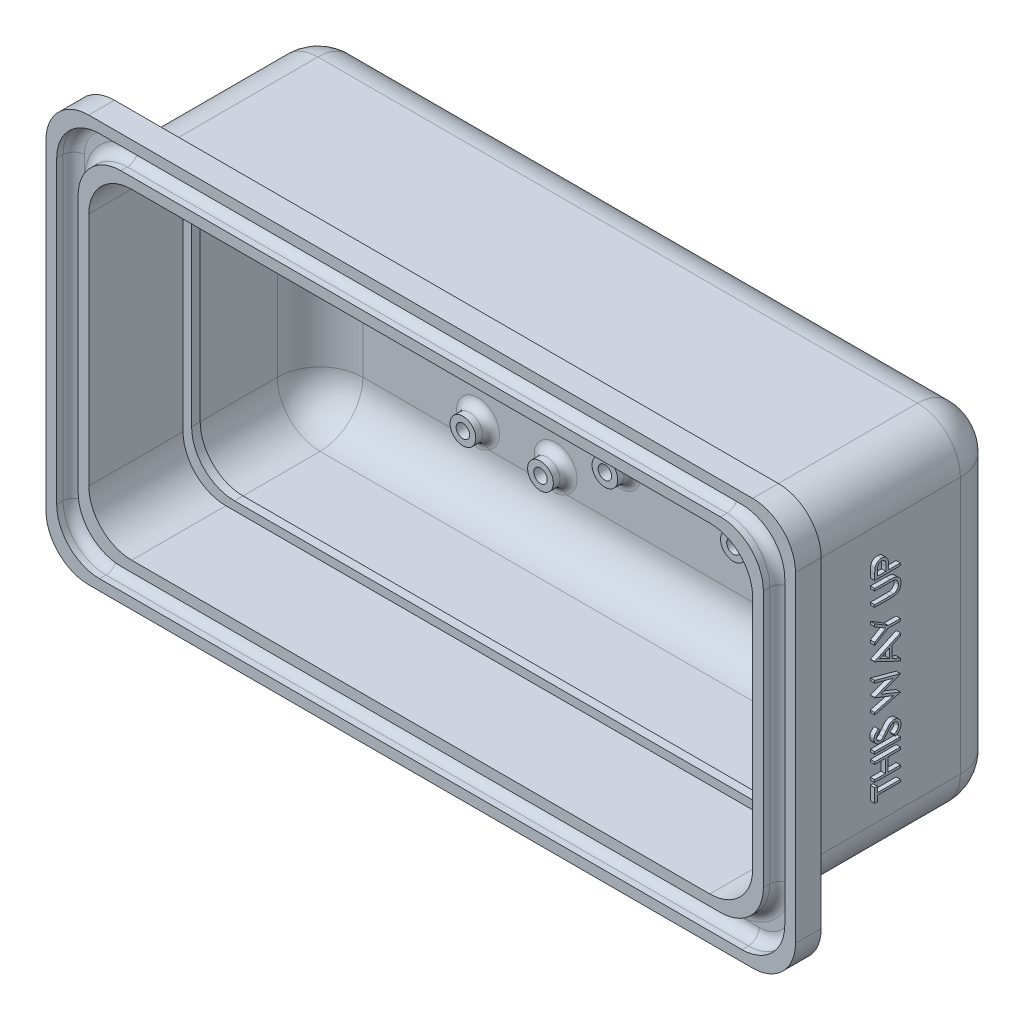
from build123d import *

# Parameters (mm, degrees)
SKETCH1_W            = 203.19999999999996
SKETCH1_H            = 101.59999999999998
BOSS_EXTRUDE1_DEPTH  = 63.5
SKETCH2_W            = 196.84999999999997
SKETCH2_H            = 95.25000000000001
CUT_EXTRUDE1_DEPTH   = 60.959999999999994
FILLET1_R            = 12.7
BOSS_EXTRUDE2_DEPTH  = 7.619999999999999
CUT_EXTRUDE2_DEPTH   = 5.08
FILLET2_R            = 3.175
SKETCH6_R            = 12.065000000000003
CUT_EXTRUDE3_DEPTH   = 6.35
SKETCH7_R            = 0.8750045999999976
SKETCH7_R_2          = 0.8750045999999996
BOSS_EXTRUDE3_DEPTH  = 2.54
CUT_EXTRUDE4_START   = -1.27
SKETCH7_2_R          = 0.8750045999999976
CUT_EXTRUDE4_DEPTH   = 1.27
SKETCH8_R            = 12.065000000000003
CUT_EXTRUDE5_DEPTH   = 250.60750719880198
SKETCH10_R           = 3.810000000000013
SKETCH10_R_2         = 1.9999999999999967
SKETCH10_R_3         = 3.81
BOSS_EXTRUDE5_DEPTH  = 4.444999999999999
CUT_EXTRUDE6_START   = -1.27
SKETCH10_2_R         = 1.9999999999999967
CUT_EXTRUDE6_DEPTH   = 1.27
BOSS_EXTRUDE6_DEPTH  = 2.54
BOSS_EXTRUDE8_DEPTH  = 17.779999999999998
FILLET5_R            = 6.35
SKETCH15_R           = 1.5000000000000042
CUT_EXTRUDE8_DEPTH   = 219.86230979773552
FILLET3_R            = 2.54
SKETCH16_R           = 3.81
SKETCH16_R_2         = 1.9999999999999967
SKETCH16_R_3         = 2.0000000000000036
BOSS_EXTRUDE9_DEPTH  = 4.5
CUT_EXTRUDE9_START   = -1.5
SKETCH16_3_R         = 2.0000000000000036
SKETCH16_3_R_2       = 1.9999999999999967
CUT_EXTRUDE9_DEPTH   = 1.5
SKETCH17_W           = 7.620000000000001
SKETCH17_H           = 0.6838461538461544
BOSS_EXTRUDE10_DEPTH = 1.27
FILLET6_R            = 2.54


# Some blends are built 0.0001 mm under size
with BuildPart() as part:
    # Sketch1 → Boss-Extrude1 (new body)
    with BuildSketch(Plane.XY):
        with Locations((101.59999999999998, 50.79999999999999)):
            Rectangle(SKETCH1_W, SKETCH1_H)
    extrude(amount=BOSS_EXTRUDE1_DEPTH)

    # Sketch2 → Cut-Extrude1 (cut)
    with BuildSketch(Plane.XY.offset(63.5)):
        with Locations((101.6, 50.800000000000004)):
            Rectangle(SKETCH2_W, SKETCH2_H)
    extrude(amount=-CUT_EXTRUDE1_DEPTH, mode=Mode.SUBTRACT)

    # Fillet1
    fillet1_edges = [part.edges().sort_by_distance(p)[0] for p in [
        (3.175, 50.8, 2.5400000000000063),
        (3.175, 3.174999999999997, 33.02),
        (101.6, 98.425, 2.5400000000000063),
        (3.175, 98.425, 33.02),
        (200.02499999999998, 50.8, 2.5400000000000063),
        (200.02499999999998, 98.425, 33.02),
        (101.59999999999998, 3.174999999999997, 2.5400000000000063),
        (200.02499999999998, 3.174999999999997, 33.02),
        (0, 50.8, 0),
        (101.6, 101.6, 0),
        (203.2, 50.8, 0),
        (101.6, 0, 0),
        (0, 0, 31.75),
        (0, 101.6, 31.75),
        (203.2, 101.6, 31.75),
        (203.2, 0, 31.75),
    ]]
    fillet(fillet1_edges, radius=FILLET1_R)

    # Sketch3 → Boss-Extrude2 (add)
    with BuildSketch(Plane.XY.offset(63.5)):
        with BuildLine():
            Line((3.174999999999999, 111.125), (200.02499999999995, 111.12499999999999))
            ThreePointArc((200.02499999999995, 111.12499999999999), (209.00525612106912, 107.40525612106916), (212.72499999999997, 98.425))
            Line((212.72499999999997, 98.425), (212.72499999999994, 3.174999999999999))
            ThreePointArc((212.72499999999994, 3.174999999999999), (209.00525612106912, -5.805256121069155), (200.02499999999998, -9.525000000000002))
            Line((200.02499999999998, -9.525000000000002), (3.1750000000000114, -9.525000000000002))
            ThreePointArc((3.1750000000000114, -9.525000000000002), (-5.8052561210691405, -5.8052561210691564), (-9.52499999999999, 3.1749999999999954))
            Line((-9.52499999999999, 3.1749999999999954), (-9.525, 98.425))
            ThreePointArc((-9.525, 98.425), (-5.8052561210691564, 107.40525612106916), (3.174999999999999, 111.125))
        make_face()
        with BuildLine():
            Line((15.875, 98.42499999999998), (187.325, 98.42500000000001))
            ThreePointArc((187.325, 98.42500000000001), (196.30525612106914, 94.70525612106914), (200.02499999999998, 85.725))
            Line((200.02499999999998, 85.725), (200.02499999999998, 15.875))
            ThreePointArc((200.02499999999998, 15.875), (196.30525612106914, 6.894743878930845), (187.325, 3.174999999999997))
            Line((187.325, 3.174999999999997), (15.875000000000007, 3.174999999999997))
            ThreePointArc((15.875000000000007, 3.174999999999997), (6.8947438789308535, 6.894743878930845), (3.1750000000000096, 15.874999999999996))
            Line((3.1750000000000096, 15.874999999999996), (3.1750000000000007, 85.725))
            ThreePointArc((3.1750000000000007, 85.725), (6.894743878930855, 94.70525612106914), (15.875, 98.42499999999998))
        make_face(mode=Mode.SUBTRACT)
    extrude(amount=BOSS_EXTRUDE2_DEPTH)

    # Sketch5 → Cut-Extrude2 (cut)
    with BuildSketch(Plane.XY.offset(71.12)):
        with BuildLine():
            Line((6.3500000000000885, -6.350000000000002), (196.85, -6.350000000000002))
            ThreePointArc((196.85, -6.350000000000002), (205.83025612106914, -2.630256121069155), (209.54999999999998, 6.349999999999997))
            Line((209.54999999999998, 6.349999999999997), (209.54999999999998, 95.25))
            ThreePointArc((209.54999999999998, 95.25), (205.83025612106914, 104.23025612106913), (196.85000000000002, 107.94999999999999))
            Line((196.85000000000002, 107.94999999999999), (6.3500000000000885, 107.94999999999999))
            ThreePointArc((6.3500000000000885, 107.94999999999999), (-2.630256121069152, 104.23025612106913), (-6.35, 95.2499999999999))
            Line((-6.35, 95.2499999999999), (-6.35, 6.350000000000088))
            ThreePointArc((-6.35, 6.350000000000088), (-2.6302561210691557, -2.630256121069155), (6.3500000000000885, -6.350000000000002))
        make_face()
        with BuildLine():
            Line((12.700000000000088, -2.6e-15), (190.5, -3.47e-15))
            ThreePointArc((190.5, -3.47e-15), (199.48025612106915, 3.719743878930844), (203.2, 12.699999999999996))
            Line((203.2, 12.699999999999996), (203.2, 88.9))
            ThreePointArc((203.2, 88.9), (199.48025612106917, 97.88025612106917), (190.5, 101.60000000000002))
            Line((190.5, 101.60000000000002), (12.700000000000088, 101.6))
            ThreePointArc((12.700000000000088, 101.6), (3.7197438789308475, 97.88025612106914), (0, 88.8999999999999))
            Line((0, 88.8999999999999), (0, 12.700000000000086))
            ThreePointArc((0, 12.700000000000086), (3.719743878930844, 3.7197438789308457), (12.700000000000088, -2.6e-15))
        make_face(mode=Mode.SUBTRACT)
    extrude(amount=-CUT_EXTRUDE2_DEPTH, mode=Mode.SUBTRACT)

    # Fillet2
    fillet2_edges = [part.edges().sort_by_distance(p)[0] for p in [
        (205.83025612106914, 104.23025612106913, 66.04),
        (209.54999999999998, 50.8, 66.04),
        (205.83025612106914, -2.630256121069154, 66.04),
        (101.60000000000005, -6.350000000000002, 66.04),
        (-2.6302561210691557, -2.6302561210691557, 66.04),
        (-6.35, 50.8, 66.04),
        (-2.630256121069147, 104.23025612106913, 66.04),
        (101.60000000000005, 107.94999999999999, 66.04),
        (199.48025612106915, 97.88025612106918, 66.04),
        (101.60000000000005, 101.60000000000001, 66.04),
        (3.719743878930853, 97.88025612106914, 66.04),
        (0, 50.8, 66.04),
        (3.7197438789308457, 3.719743878930844, 66.04),
        (101.60000000000004, -3.04e-15, 66.04),
        (199.48025612106915, 3.7197438789308457, 66.04),
        (203.2, 50.800000000000004, 66.04),
    ]]
    fillet(fillet2_edges, radius=FILLET2_R - 0.0001)  # a hair under: the kernel refuses the full size

    # Sketch6 → Cut-Extrude3 (cut)
    with BuildSketch(Plane(origin=(0, 0, 0), x_dir=(-1, 0, 0), z_dir=(0, 0, -1))):
        with Locations((-161.92499999999993, 50.8)):
            Circle(SKETCH6_R)
    extrude(amount=-CUT_EXTRUDE3_DEPTH, mode=Mode.SUBTRACT)

    # Sketch7 → Boss-Extrude3 (add)
    # profile 1 of 2: a face of its own
    with BuildSketch(Plane.XY.offset(2.5400000000000076)):
        with BuildLine():
            ThreePointArc((163.48303492183743, 62.76397727272725), (161.9249999999999, 67.31000000000003), (160.36696507816237, 62.76397727272724))
            ThreePointArc((160.36696507816237, 62.76397727272724), (161.9249999999999, 62.86499999999998), (163.48303492183743, 62.76397727272725))
        make_face()
        with Locations((161.9249999999999, 64.77000000000001)):
            Circle(SKETCH7_R, mode=Mode.SUBTRACT)
    # profile 2 of 2: a face of its own
    with BuildSketch(Plane.XY.offset(2.5400000000000076)):
        with BuildLine():
            ThreePointArc((160.36696507816237, 38.836022727272756), (161.9249999999999, 34.28999999999998), (163.48303492183743, 38.83602272727275))
            ThreePointArc((163.48303492183743, 38.83602272727275), (161.9249999999999, 38.73500000000003), (160.36696507816237, 38.836022727272756))
        make_face()
        with Locations((161.9249999999999, 36.83)):
            Circle(SKETCH7_R_2, mode=Mode.SUBTRACT)
    extrude(amount=BOSS_EXTRUDE3_DEPTH)

    # Sketch7<2> → Cut-Extrude4 (cut)
    with BuildSketch(Plane.XY.offset(2.5400000000000076).offset(CUT_EXTRUDE4_START)):
        with Locations((161.9249999999999, 64.77000000000001)):
            Circle(SKETCH7_2_R)
    extrude(amount=CUT_EXTRUDE4_DEPTH, mode=Mode.SUBTRACT)

    # Sketch8 → Cut-Extrude5 (cut, through all)
    with BuildSketch(Plane.XY.offset(2.5400000000000076)):
        with Locations((111.12499999999993, 50.80000000000002)):
            Circle(SKETCH8_R)
    extrude(amount=-CUT_EXTRUDE5_DEPTH, mode=Mode.SUBTRACT)

    # Sketch10 → Boss-Extrude5 (add)
    # profile 1 of 4: a face of its own
    with BuildSketch(Plane.XY.offset(2.5400000000000076)):
        with Locations(Location((130.17499999999993, 69.85000000000002, 0), (0, 0, 180))):
            Circle(SKETCH10_R)
        with Locations((130.17499999999993, 69.85000000000002)):
            Circle(SKETCH10_R_2, mode=Mode.SUBTRACT)
    # profile 2 of 4: a face of its own
    with BuildSketch(Plane.XY.offset(2.5400000000000076)):
        with Locations(Location((130.17499999999993, 31.750000000000036, 0), (0, 0, 180))):
            Circle(SKETCH10_R)
        with Locations((130.17499999999993, 31.750000000000036)):
            Circle(SKETCH10_R_2, mode=Mode.SUBTRACT)
    # profile 3 of 4: a face of its own
    with BuildSketch(Plane.XY.offset(2.5400000000000076)):
        with Locations(Location((92.07499999999993, 31.75000000000003, 0), (0, 0, 180))):
            Circle(SKETCH10_R_3)
        with Locations((92.07499999999993, 31.75000000000003)):
            Circle(SKETCH10_R_2, mode=Mode.SUBTRACT)
    # profile 4 of 4: a face of its own
    with BuildSketch(Plane.XY.offset(2.5400000000000076)):
        with Locations(Location((92.07499999999993, 69.85000000000002, 0), (0, 0, 180))):
            Circle(SKETCH10_R_3)
        with Locations((92.07499999999993, 69.85000000000002)):
            Circle(SKETCH10_R_2, mode=Mode.SUBTRACT)
    extrude(amount=BOSS_EXTRUDE5_DEPTH)

    # Sketch10<2> → Cut-Extrude6 (cut)
    with BuildSketch(Plane.XY.offset(2.5400000000000076).offset(CUT_EXTRUDE6_START)):
        with Locations((130.17499999999993, 69.85000000000002)):
            Circle(SKETCH10_2_R)
        with Locations((130.17499999999993, 31.750000000000036)):
            Circle(SKETCH10_2_R)
        with Locations((92.07499999999993, 69.85000000000002)):
            Circle(SKETCH10_2_R)
        with Locations((92.07499999999993, 31.75000000000003)):
            Circle(SKETCH10_2_R)
    extrude(amount=CUT_EXTRUDE6_DEPTH, mode=Mode.SUBTRACT)

    # Sketch11 → Boss-Extrude6 (add)
    with BuildSketch(Plane.XY.offset(40.64000000000001)):
        with BuildLine():
            Line((3.175, 15.874999999999993), (3.1750000000000007, 85.725))
            ThreePointArc((3.1750000000000007, 85.725), (6.894743878930855, 94.70525612106914), (15.875, 98.42499999999998))
            Line((15.875, 98.42499999999998), (187.325, 98.42500000000001))
            ThreePointArc((187.325, 98.42500000000001), (196.30525612106916, 94.70525612106916), (200.025, 85.725))
            Line((200.025, 85.725), (200.02499999999998, 15.874999999999993))
            ThreePointArc((200.02499999999998, 15.874999999999993), (196.30525612106914, 6.894743878930843), (187.325, 3.174999999999997))
            Line((187.325, 3.174999999999997), (15.874999999999996, 3.174999999999997))
            ThreePointArc((15.874999999999996, 3.174999999999997), (6.894743878930845, 6.894743878930841), (3.175, 15.874999999999993))
        make_face()
        with BuildLine():
            Line((184.785, 95.885), (18.41500000000006, 95.88499999999999))
            ThreePointArc((18.41500000000006, 95.88499999999999), (9.434743878930812, 92.16525612106915), (5.71499999999997, 83.1849999999999))
            Line((5.71499999999997, 83.1849999999999), (5.71499999999997, 18.415000000000106))
            ThreePointArc((5.71499999999997, 18.415000000000106), (9.434743878930817, 9.434743878930862), (18.41500000000006, 5.715000000000017))
            Line((18.41500000000006, 5.715000000000017), (184.785, 5.715000000000038))
            ThreePointArc((184.785, 5.715000000000038), (193.76525612106914, 9.434743878930894), (197.48499999999999, 18.41500000000004))
            Line((197.48499999999999, 18.41500000000004), (197.48499999999999, 83.185))
            ThreePointArc((197.48499999999999, 83.185), (193.76525612106914, 92.16525612106916), (184.785, 95.885))
        make_face(mode=Mode.SUBTRACT)
    extrude(amount=BOSS_EXTRUDE6_DEPTH)

    # Sketch14 → Boss-Extrude8 (add)
    with BuildSketch(Plane.XZ):
        Polygon((38.10000000000004, 63.5), (63.500000000000014, 63.5), (63.50000000000004, 50.8), (38.100000000000044, 50.8), align=None)
        Polygon((139.70000000000002, 63.5), (165.1, 63.5), (165.09999999999997, 50.800000000000004), (139.70000000000005, 50.8), align=None)
    extrude(amount=BOSS_EXTRUDE8_DEPTH)

    # Fillet5
    fillet5_edges = [part.edges().sort_by_distance(p)[0] for p in [
        (152.4, -17.779999999999998, 50.8),
        (152.4, -17.779999999999998, 63.5),
        (50.80000000000004, -17.779999999999998, 50.8),
        (50.800000000000026, -17.779999999999998, 63.5),
    ]]
    fillet(fillet5_edges, radius=FILLET5_R - 0.0001)  # a hair under: the kernel refuses the full size

    # Sketch15 → Cut-Extrude8 (cut, through all)
    with BuildSketch(Plane.ZY.offset(-38.10000000000007)):
        with Locations((57.15, -11.429999999999998)):
            Circle(SKETCH15_R)
    extrude(amount=-CUT_EXTRUDE8_DEPTH, mode=Mode.SUBTRACT)

    # Fillet3
    # the kernel refuses this fillet: 2.54 mm, written as the material it adds along each edge
    with BuildSketch(Plane(origin=(92.07499999999993, 31.75000000000003, 2.5400000000000076), x_dir=(-1, 0, 0), z_dir=(0, 1, 0))) as fillet3_piece_1:
        with BuildLine():
            CenterArc((3.8100000000000023 + FILLET3_R, FILLET3_R), FILLET3_R, 179.99999999999997, 90)
            Line((3.8100000000000023, FILLET3_R), (3.8100000000000023, 0))
            Line((3.8100000000000023, 0), (3.8100000000000023 + FILLET3_R, -1.33e-15))
        make_face()
    revolve(axis=Axis((92.07499999999993, 31.75000000000003, 2.5400000000000076), (0, 0, 1)))
    with BuildSketch(Plane(origin=(92.07499999999993, 69.85000000000002, 2.5400000000000076), x_dir=(-1, 0, 0), z_dir=(0, 1, 0))) as fillet3_piece_2:
        with BuildLine():
            CenterArc((3.8100000000000023 + FILLET3_R, FILLET3_R), FILLET3_R, 179.99999999999997, 90)
            Line((3.8100000000000023, FILLET3_R), (3.8100000000000023, 0))
            Line((3.8100000000000023, 0), (3.8100000000000023 + FILLET3_R, -1.33e-15))
        make_face()
    revolve(axis=Axis((92.07499999999993, 69.85000000000002, 2.5400000000000076), (0, 0, 1)))
    with BuildSketch(Plane(origin=(130.17499999999993, 31.750000000000036, 2.5400000000000076), x_dir=(-1, 0, 0), z_dir=(0, 1, 0))) as fillet3_piece_3:
        with BuildLine():
            CenterArc((3.8100000000000165 + FILLET3_R, FILLET3_R), FILLET3_R, 179.99999999999997, 90)
            Line((3.8100000000000165, FILLET3_R), (3.8100000000000165, 0))
            Line((3.8100000000000165, 0), (3.8100000000000165 + FILLET3_R, -1.33e-15))
        make_face()
    revolve(axis=Axis((130.17499999999993, 31.750000000000036, 2.5400000000000076), (0, 0, 1)))
    with BuildSketch(Plane(origin=(130.17499999999993, 69.85000000000002, 2.5400000000000076), x_dir=(-1, 0, 0), z_dir=(0, 1, 0))) as fillet3_piece_4:
        with BuildLine():
            CenterArc((3.8100000000000165 + FILLET3_R, FILLET3_R), FILLET3_R, 179.99999999999997, 90)
            Line((3.8100000000000165, FILLET3_R), (3.8100000000000165, 0))
            Line((3.8100000000000165, 0), (3.8100000000000165 + FILLET3_R, -1.33e-15))
        make_face()
    revolve(axis=Axis((130.17499999999993, 69.85000000000002, 2.5400000000000076), (0, 0, 1)))
    with BuildSketch(Plane(origin=(161.9249999999999, 36.83, 2.5400000000000076), x_dir=(-0.0031415874858781493, 0.9999950652018582, 0), z_dir=(0.9999950652018582, 0.0031415874858781493, 0))) as fillet3_piece_5_section:
        with BuildLine():
            CenterArc((2.5400000000008656 + FILLET3_R, FILLET3_R), FILLET3_R, 180.00000000000003, 90)
            Line((2.5400000000008656, FILLET3_R), (2.5400000000008656, -1.33e-15))
            Line((2.5400000000008656, -1.33e-15), (2.5400000000008656 + FILLET3_R, -1.33e-15))
        make_face()
    fillet3_piece_5 = revolve(axis=Axis((161.9249999999999, 36.83, 2.5400000000000076), (0, 0, 1)), revolution_arc=359.64000000000004, mode=Mode.PRIVATE)
    fillet3_piece_5 = fillet3_piece_5 - Plane(origin=(161.92499999999993, 50.8, 3.263586061456452), x_dir=(-1, 0, 0), z_dir=(0, 0, -1)) * Cylinder(12.065000000000003, 21, mode=Mode.PRIVATE)
    add(fillet3_piece_5)
    with BuildSketch(Plane(origin=(161.92499999999987, 64.77000000000001, 2.5400000000000076), x_dir=(0.0031415874858893296, -0.9999950652018581, 0), z_dir=(-0.9999950652018581, -0.0031415874858893296, 0))) as fillet3_piece_6_section:
        with BuildLine():
            CenterArc((2.540000000000304 + FILLET3_R, FILLET3_R), FILLET3_R, 180.00000000000003, 90)
            Line((2.540000000000304, FILLET3_R), (2.540000000000304, -1.33e-15))
            Line((2.540000000000304, -1.33e-15), (2.540000000000304 + FILLET3_R, -1.33e-15))
        make_face()
    fillet3_piece_6 = revolve(axis=Axis((161.92499999999987, 64.77000000000001, 2.5400000000000076), (0, 0, 1)), revolution_arc=359.64, mode=Mode.PRIVATE)
    fillet3_piece_6 = fillet3_piece_6 - Plane(origin=(161.92499999999993, 50.8, 3.263586061456447), x_dir=(-1, 0, 0), z_dir=(0, 0, -1)) * Cylinder(12.065000000000003, 21, mode=Mode.PRIVATE)
    add(fillet3_piece_6)

    # Sketch16 → Boss-Extrude9 (add)
    # profile 1 of 4: a face of its own
    with BuildSketch(Plane.XY.offset(2.5400000000000076)):
        with Locations(Location((73.02499999999993, 79.375, 0), (0, 0, 180))):
            Circle(SKETCH16_R)
        with Locations((73.02499999999993, 79.375)):
            Circle(SKETCH16_R_2, mode=Mode.SUBTRACT)
    # profile 2 of 4: a face of its own
    with BuildSketch(Plane.XY.offset(2.5400000000000076)):
        with Locations(Location((50.024999999999935, 79.375, 0), (0, 0, 180))):
            Circle(SKETCH16_R)
        with Locations((50.024999999999935, 79.375)):
            Circle(SKETCH16_R_3, mode=Mode.SUBTRACT)
    # profile 3 of 4: a face of its own
    with BuildSketch(Plane.XY.offset(2.5400000000000076)):
        with Locations(Location((50.02499999999994, 21.374999999999996, 0), (0, 0, 180))):
            Circle(SKETCH16_R)
        with Locations((50.02499999999994, 21.374999999999996)):
            Circle(SKETCH16_R_3, mode=Mode.SUBTRACT)
    # profile 4 of 4: a face of its own
    with BuildSketch(Plane.XY.offset(2.5400000000000076)):
        with Locations(Location((73.02499999999996, 21.374999999999996, 0), (0, 0, 180))):
            Circle(SKETCH16_R)
        with Locations((73.02499999999996, 21.374999999999996)):
            Circle(SKETCH16_R_2, mode=Mode.SUBTRACT)
    extrude(amount=BOSS_EXTRUDE9_DEPTH)

    # Sketch16<3> → Cut-Extrude9 (cut)
    with BuildSketch(Plane.XY.offset(2.5400000000000076).offset(CUT_EXTRUDE9_START)):
        with Locations((50.024999999999935, 79.375)):
            Circle(SKETCH16_3_R)
        with Locations((73.02499999999993, 79.375)):
            Circle(SKETCH16_3_R_2)
        with Locations((73.02499999999996, 21.374999999999996)):
            Circle(SKETCH16_3_R_2)
        with Locations((50.02499999999994, 21.374999999999996)):
            Circle(SKETCH16_3_R)
    extrude(amount=CUT_EXTRUDE9_DEPTH, mode=Mode.SUBTRACT)

    # Sketch17 → Boss-Extrude10 (add)
    # profile 1 of 9: a face of its own
    with BuildSketch(Plane(origin=(203.2, 0, 0), x_dir=(0, 0, -1), z_dir=(1, 0, 0))):
        Polygon((-38.58846153846154, 19.147692307692306), (-39.370000000000005, 19.147692307692306), (-39.370000000000005, 23.153076923076924), (-38.58846153846154, 23.153076923076924), (-38.58846153846154, 21.49230769230769), (-31.75, 21.49230769230769), (-31.75, 20.808461538461536), (-38.58846153846154, 20.808461538461536), align=None)
    # profile 2 of 9: a face of its own
    with BuildSketch(Plane(origin=(203.2, 0, 0), x_dir=(0, 0, -1), z_dir=(1, 0, 0))):
        Polygon((-39.370000000000005, 24.520769230769226), (-39.370000000000005, 25.204615384615376), (-36.24384615384616, 25.204615384615376), (-36.24384615384616, 29.112307692307688), (-39.370000000000005, 29.112307692307688), (-39.370000000000005, 29.79615384615384), (-31.75, 29.79615384615384), (-31.75, 29.112307692307688), (-35.4623076923077, 29.112307692307688), (-35.4623076923077, 25.204615384615376), (-31.75, 25.204615384615376), (-31.75, 24.520769230769226), align=None)
    # profile 3 of 9: a face of its own
    with BuildSketch(Plane(origin=(203.2, 0, 0), x_dir=(0, 0, -1), z_dir=(1, 0, 0))):
        with Locations((-35.56, 32.09192307692307)):
            Rectangle(SKETCH17_W, SKETCH17_H)
    # profile 4 of 9: a face of its own
    with BuildSketch(Plane(origin=(203.2, 0, 0), x_dir=(0, 0, -1), z_dir=(1, 0, 0))):
        with BuildLine():
            Line((-33.21996394230769, 33.313076923076935), (-33.606153846153845, 33.95723557692308))
            add(Edge.make_bspline(
                [(-33.606153846153845, 33.95723557692308), (-33.50586509949757, 34.01714671059424), (-33.3137157311015, 34.131934130704906), (-33.05407394022514, 34.323416804059754), (-32.83339404465269, 34.52182617065528), (-32.65295983052312, 34.728631519697196), (-32.51090368280402, 34.942570526752206), (-32.41031482403393, 35.16503980945896), (-32.3475783290826, 35.39528967163643), (-32.33995814064075, 35.55198696297164), (-32.33615384615385, 35.63021634615385)],
                knots=[0, 0, 0, 0, 1.2720343881390284, 2.4371687991745272, 3.5083752366367564, 4.49857839020744, 5.419460340205852, 6.295179143510037, 7.148887112834139, 7.999999999999999, 7.999999999999999, 7.999999999999999, 7.999999999999999], degree=3))
            add(Edge.make_bspline(
                [(-32.33615384615385, 35.63021634615385), (-32.338058858284576, 35.697012499827885), (-32.34183554930862, 35.829436031390344), (-32.37665851648154, 36.02476689177914), (-32.433628819110474, 36.21352302297114), (-32.51085823183636, 36.39382807008148), (-32.60578997080509, 36.56090513035463), (-32.71773230674191, 36.709764886681526), (-32.847077669145904, 36.835461168928425), (-32.98903442306459, 36.9396649070199), (-33.14125967265619, 37.02029700221569), (-33.298106169061256, 37.081239523505424), (-33.46172596419784, 37.11537061775824), (-33.571916584655554, 37.12049228499276), (-33.62752403846154, 37.12307692307692)],
                knots=[0, 0, 0, 0, 1.0955386404019962, 2.1719079280089697, 3.2445452759525826, 4.3257307021995075, 5.384330216132951, 6.3914801479321355, 7.371786628480884, 8.333890167273031, 9.271656869931414, 10.191402356478413, 11.087295184490607, 11.999999999999998, 11.999999999999998, 11.999999999999998, 11.999999999999998], degree=3))
            add(Edge.make_bspline(
                [(-33.62752403846154, 37.12307692307692), (-33.690989006921285, 37.11993607731537), (-33.81951248850284, 37.113575522158996), (-34.00945822481281, 37.05751952740479), (-34.198243206405884, 36.97192436930216), (-34.31504087435414, 36.89147454022017), (-34.37548076923077, 36.849843750000005)],
                knots=[0, 0, 0, 0, 0.9389925593168004, 1.901562323773923, 2.914110574429912, 3.9999999999999996, 3.9999999999999996, 3.9999999999999996, 3.9999999999999996], degree=3))
            add(Edge.make_bspline(
                [(-34.37548076923077, 36.849843750000005), (-34.41913108611381, 36.815731585762954), (-34.5107694663445, 36.74411736391842), (-34.647060203094995, 36.62089575952769), (-34.787928846813244, 36.47703972457347), (-34.93646795820169, 36.31451815850117), (-35.09144379203498, 36.13305844332404), (-35.25406569974443, 35.93259037179957), (-35.42101048772375, 35.71140306422936), (-35.532831199866976, 35.55615243927896), (-35.590528846153845, 35.476045673076925)],
                knots=[0, 0, 0, 0, 0.7222505101257691, 1.5162746022224691, 2.39363863329321, 3.346993199744025, 4.386926276238035, 5.505032946248393, 6.712638081035009, 8, 8, 8, 8], degree=3))
            add(Edge.make_bspline(
                [(-35.590528846153845, 35.476045673076925), (-35.64763222834221, 35.39587457282424), (-35.75680954671521, 35.24259353409825), (-35.91884184505342, 35.02823513481843), (-36.06698306959893, 34.83654976106542), (-36.20262780451932, 34.66838938794897), (-36.32579444681692, 34.52382797995839), (-36.43530024574931, 34.401726382264755), (-36.534106741125555, 34.30519500938813), (-36.59820474801074, 34.2515162880687), (-36.62698317307692, 34.22741586538462)],
                knots=[0, 0, 0, 0, 1.4522824110102917, 2.776653379853045, 3.9645425314524356, 5.026858415017715, 5.96415735993724, 6.766646006061229, 7.446254459078068, 8, 8, 8, 8], degree=3))
            add(Edge.make_bspline(
                [(-36.62698317307692, 34.22741586538462), (-36.67183679979024, 34.19373557017547), (-36.76004747637648, 34.127498749527454), (-36.89788301108027, 34.03997116095106), (-37.03871168369345, 33.96615890720685), (-37.183043888654616, 33.90675384301742), (-37.329794883578174, 33.8587152182665), (-37.48006641714296, 33.82531605045126), (-37.63283835649047, 33.80472950954147), (-37.73562533375598, 33.80260297871365), (-37.78707932692307, 33.80153846153846)],
                knots=[0, 0, 0, 0, 1.068019516618223, 2.1004037147396892, 3.106014850592175, 4.0922478697283164, 5.069873182358848, 6.043214338734218, 7.020455326902664, 8, 8, 8, 8], degree=3))
            add(Edge.make_bspline(
                [(-37.78707932692307, 33.80153846153846), (-37.867698593745324, 33.804379961471696), (-38.02721394724774, 33.810002226275046), (-38.260233068291484, 33.85755398783821), (-38.48271601945736, 33.93259956202368), (-38.69240890542324, 34.03777012344944), (-38.88404314041477, 34.17321718682735), (-39.059343614180406, 34.330644701029975), (-39.20872512099518, 34.51641345616149), (-39.33720891188608, 34.72207327772388), (-39.43881448496834, 34.94600134464466), (-39.51244839809507, 35.181748905706236), (-39.55618601746239, 35.427621331037), (-39.5622882886803, 35.59442525282312), (-39.565384615384616, 35.67906250000001)],
                knots=[0, 0, 0, 0, 1.0052487785359678, 1.989011071256525, 2.954843729650132, 3.928844559102959, 4.904706340781174, 5.875556129154497, 6.859318421875067, 7.868909461522038, 8.894684145533267, 9.918924798252057, 10.944050749179247, 12, 12, 12, 12], degree=3))
            add(Edge.make_bspline(
                [(-39.565384615384616, 35.67906250000001), (-39.56232957124244, 35.76887133772138), (-39.55625406351219, 35.94747245195324), (-39.50211443927363, 36.20976530452455), (-39.41594877735438, 36.46333193584083), (-39.31485388162839, 36.66640545942955), (-39.214526928520044, 36.82567739373774), (-39.12294626497629, 36.94702066119295), (-39.01773302641322, 37.070652297230346), (-38.89666915542765, 37.195243632220915), (-38.76217605144114, 37.3220246412753), (-38.613115219687394, 37.450411340951426), (-38.45082994144209, 37.58160521087419), (-38.334947644598735, 37.66597751273644), (-38.27554086538461, 37.70923076923077)],
                knots=[0, 0, 0, 0, 1.2865074251446234, 2.558452658203269, 3.8227382188922556, 5.118007102761251, 5.800084425137225, 6.5194188732203635, 7.295692131645175, 8.12638275989507, 9.008892965875352, 9.945018125840654, 10.946518512208721, 12, 12, 12, 12], degree=3))
            Line((-38.27554086538461, 37.70923076923077), (-37.80692307692308, 37.09102163461539))
            add(Edge.make_bspline(
                [(-37.80692307692308, 37.09102163461539), (-37.855016094617184, 37.0536952117154), (-37.94763200212623, 36.981813248455445), (-38.077290244834685, 36.87263799214124), (-38.19588814771295, 36.76989361199774), (-38.298628738515305, 36.66789091295642), (-38.393205636067464, 36.574492236714164), (-38.472741743297114, 36.482233247880835), (-38.53975002317504, 36.39467423332303), (-38.611390791590175, 36.284571192285235), (-38.68025778066864, 36.145095860784195), (-38.740749335160395, 35.97147151935646), (-38.776636153748115, 35.78941376637623), (-38.7814229035337, 35.66548051284392), (-38.783846153846156, 35.60274038461539)],
                knots=[0, 0, 0, 0, 1.1813921374714846, 2.2750850369149815, 3.289537921649177, 4.225335852793274, 5.084247275665556, 5.8683121797625555, 6.587234301211791, 7.222706459382311, 8.415108400575853, 9.595592187616838, 10.782789524497899, 12, 12, 12, 12], degree=3))
            add(Edge.make_bspline(
                [(-38.783846153846156, 35.60274038461539), (-38.78125130649875, 35.524003893737124), (-38.776247387831106, 35.37216798827405), (-38.72015901974437, 35.15710765918162), (-38.63488043546526, 34.96242439392129), (-38.51190960592187, 34.79555019238528), (-38.36530469129357, 34.65776475212768), (-38.198112111062315, 34.556859196196626), (-38.01345441196444, 34.496529537843145), (-37.884704748965056, 34.48914529271761), (-37.81913461538461, 34.48538461538462)],
                knots=[0, 0, 0, 0, 1.1442488809233378, 2.2065761754449484, 3.2149495477528927, 4.2229960390628385, 5.203671638256503, 6.1277101273268695, 7.046472866860482, 8, 8, 8, 8], degree=3))
            add(Edge.make_bspline(
                [(-37.81913461538461, 34.48538461538462), (-37.77831932946506, 34.48628940300387), (-37.69612018423017, 34.48811158229888), (-37.57525586138473, 34.51139608621352), (-37.45502881706866, 34.54287864903239), (-37.33586218824394, 34.59114292676117), (-37.21505752587355, 34.65835493097738), (-37.09090856295406, 34.74652268458014), (-36.96234595052147, 34.85759147107164), (-36.8787274018642, 34.942666880873404), (-36.83457932692308, 34.98758413461539)],
                knots=[0, 0, 0, 0, 0.8582591222134353, 1.7284741401803634, 2.583651050890655, 3.473048462997288, 4.42739252937954, 5.48864998470362, 6.674082838568387, 8, 8, 8, 8], degree=3))
            add(Edge.make_bspline(
                [(-36.83457932692308, 34.98758413461539), (-36.81969414500406, 35.0042640368287), (-36.78433036001294, 35.04389166642393), (-36.726435166154275, 35.11633811046286), (-36.65501884475715, 35.21200785975205), (-36.56665445860345, 35.328402709171336), (-36.46415138965099, 35.467668793845675), (-36.34882026831152, 35.62982142750908), (-36.21691706898797, 35.81305310756686), (-36.12469865200292, 35.94307625018253), (-36.0759375, 36.01182692307693)],
                knots=[0, 0, 0, 0, 0.4207542522331153, 0.9996157918003419, 1.7447511914287452, 2.668019285860146, 3.7503134280355654, 4.999500687716771, 6.4134643834258105, 8, 8, 8, 8], degree=3))
            add(Edge.make_bspline(
                [(-36.0759375, 36.01182692307693), (-36.01575826892532, 36.09452762448328), (-35.89922952862226, 36.25466607067084), (-35.724153680306856, 36.48252136244261), (-35.55292428349753, 36.689116036317444), (-35.386645936254354, 36.87519071737495), (-35.22654274488109, 37.042532496588464), (-35.07081265005946, 37.18945447121731), (-34.920476908279866, 37.316623261792444), (-34.72904780329674, 37.45539925055133), (-34.49176442028735, 37.59552186093727), (-34.20091647724732, 37.71566548267916), (-33.90923389148967, 37.79209879769586), (-33.71344146899853, 37.80202537662516), (-33.616838942307695, 37.806923076923084)],
                knots=[0, 0, 0, 0, 1.1636040382636708, 2.2531579478330857, 3.26857477270317, 4.215621239345326, 5.091738612649837, 5.902582348182215, 6.650434646325173, 7.330118262451161, 8.591011492278563, 9.774602830179282, 10.90200556916319, 12, 12, 12, 12], degree=3))
            add(Edge.make_bspline(
                [(-33.616838942307695, 37.806923076923084), (-33.54852448256691, 37.80549093511945), (-33.41322218373406, 37.80265446273834), (-33.21453632148064, 37.770103620665736), (-33.02161339407244, 37.72230251715562), (-32.837028884708666, 37.65083589327407), (-32.65782108506265, 37.56218583773315), (-32.487365921794954, 37.45131014366217), (-32.322351818461186, 37.322118973986086), (-32.16740497640512, 37.173997336980065), (-32.024988865048634, 37.01200120755019), (-31.898826688261334, 36.84016617825873), (-31.791209339979712, 36.660286051769646), (-31.705502675223062, 36.47041284756342), (-31.638018900352783, 36.27258630730912), (-31.589260440313147, 36.066154072252075), (-31.55930210291308, 35.85090703034181), (-31.55619506454668, 35.7046011550313), (-31.55461538461538, 35.63021634615385)],
                knots=[0, 0, 0, 0, 0.9839229379043705, 1.9487387571823998, 2.895227473219687, 3.844781104370559, 4.79611804271497, 5.772795661254202, 6.770647148075935, 7.813532943117918, 8.858274500026106, 9.87648995075291, 10.882905460790127, 11.8742650284128, 12.874055871030864, 13.89176917142634, 14.92813363154315, 16, 16, 16, 16], degree=3))
            add(Edge.make_bspline(
                [(-31.55461538461538, 35.63021634615385), (-31.555728300111394, 35.57266282816202), (-31.55794011507941, 35.45828061943775), (-31.577493643654183, 35.28909597376605), (-31.60515883069364, 35.12332921946232), (-31.649080636461274, 34.963060379987574), (-31.70237061081096, 34.80622475938781), (-31.76798569466946, 34.653503773092005), (-31.84661941043075, 34.504826044199284), (-31.93651916867664, 34.35934827955541), (-32.041168793315734, 34.21747946556237), (-32.16294717474035, 34.08039642583096), (-32.29874899883193, 33.94449288787681), (-32.45067217264444, 33.81073290529375), (-32.62038732463812, 33.682034699283335), (-32.805366478513484, 33.55530863851873), (-33.00615972157163, 33.43117231668433), (-33.147364730821465, 33.353177312239204), (-33.21996394230769, 33.313076923076935)],
                knots=[0, 0, 0, 0, 0.9153138731757586, 1.8191003112036692, 2.706792138007329, 3.5864752205946138, 4.459428224944664, 5.340599899987828, 6.22773790008054, 7.133009489466305, 8.05910615794747, 9.028520401773758, 10.047404262949783, 11.114294124038809, 12.246039232080134, 13.43383478138037, 14.680630578157714, 15.999999999999998, 15.999999999999998, 15.999999999999998, 15.999999999999998], degree=3))
        make_face()
    # profile 5 of 9: a face of its own
    with BuildSketch(Plane(origin=(203.2, 0, 0), x_dir=(0, 0, -1), z_dir=(1, 0, 0))):
        Polygon((-39.370000000000005, 41.8123076923077), (-39.370000000000005, 42.51905048076923), (-33.781694711538464, 44.010384615384616), (-39.370000000000005, 46.228305288461534), (-39.370000000000005, 46.32752403846154), (-33.81985576923077, 48.50423076923077), (-39.370000000000005, 50.003197115384616), (-39.370000000000005, 50.70230769230769), (-31.75, 48.64771634615385), (-31.75, 48.55002403846154), (-37.57795673076923, 46.2573076923077), (-31.75, 43.93711538461539), (-31.75, 43.83942307692308), align=None)
    # profile 6 of 9: a face of its own
    with BuildSketch(Plane(origin=(203.2, 0, 0), x_dir=(0, 0, -1), z_dir=(1, 0, 0))):
        Polygon((-39.370000000000005, 55.58692307692307), (-31.75, 59.10384615384615), (-31.75, 58.36046874999999), (-34.19230769230769, 57.23395432692307), (-34.19230769230769, 53.779615384615376), (-31.75, 52.621045673076914), (-31.75, 51.874615384615375), (-39.370000000000005, 55.48923076923076), align=None)
        Polygon((-37.88477163461538, 55.53044471153845), (-34.973846153846154, 54.150540865384606), (-34.973846153846154, 56.87371394230768), align=None, mode=Mode.SUBTRACT)
    # profile 7 of 9: a face of its own
    with BuildSketch(Plane(origin=(203.2, 0, 0), x_dir=(0, 0, -1), z_dir=(1, 0, 0))):
        Polygon((-39.370000000000005, 59.68999999999998), (-39.370000000000005, 60.473064903846144), (-36.09578125, 62.47575721153844), (-39.370000000000005, 64.47539663461538), (-39.370000000000005, 65.25846153846153), (-35.37224759615384, 62.816153846153824), (-31.75, 62.816153846153824), (-31.75, 62.132307692307684), (-35.37224759615384, 62.132307692307684), align=None)
    # profile 8 of 9: a face of its own
    with BuildSketch(Plane(origin=(203.2, 0, 0), x_dir=(0, 0, -1), z_dir=(1, 0, 0))):
        with BuildLine():
            Line((-39.370000000000005, 69.45923076923077), (-39.370000000000005, 70.14307692307692))
            Line((-39.370000000000005, 70.14307692307692), (-34.80441105769231, 70.14307692307692))
            add(Edge.make_bspline(
                [(-34.80441105769231, 70.14307692307692), (-34.73979185587094, 70.14297515477055), (-34.61716578460283, 70.14278203187152), (-34.442627941735275, 70.14407201921433), (-34.28745761659981, 70.14768470130261), (-34.15105668275126, 70.14996234011235), (-34.03405104399803, 70.15502927769454), (-33.93580679616621, 70.15916159694537), (-33.85678913253675, 70.16447503755141), (-33.810675230677376, 70.17086085336506), (-33.79085336538461, 70.17360576923076)],
                knots=[0, 0, 0, 0, 1.5286287337257805, 2.900836450479769, 4.128790002228466, 5.200304208318715, 6.127813767894345, 6.898992206395108, 7.526736465769394, 8, 8, 8, 8], degree=3))
            add(Edge.make_bspline(
                [(-33.79085336538461, 70.17360576923076), (-33.71879297068047, 70.18474943835506), (-33.579683617405394, 70.20626179075549), (-33.38173197657168, 70.26341609539442), (-33.202999613600355, 70.33961199043242), (-33.03945495853635, 70.43413755571738), (-32.89213735542273, 70.55357101639576), (-32.75991612332665, 70.7018513456871), (-32.6397606304838, 70.87632007766324), (-32.53500231589592, 71.07447758627683), (-32.44799170783364, 71.28561475917928), (-32.38288544157899, 71.50216233054114), (-32.34304044825598, 71.71994093753085), (-32.33843889024965, 71.86576145008043), (-32.33615384615385, 71.93817307692308)],
                knots=[0, 0, 0, 0, 1.0427771442297993, 2.013034410086226, 2.9395677229059944, 3.8175554038527655, 4.708046774559007, 5.641195415079835, 6.651191521667591, 7.73278391541841, 8.843021185810484, 9.914367357886407, 10.964315445262102, 12.000000000000002, 12.000000000000002, 12.000000000000002, 12.000000000000002], degree=3))
            add(Edge.make_bspline(
                [(-32.33615384615385, 71.93817307692308), (-32.33847881174884, 72.00034411429681), (-32.34311531454976, 72.12432710550272), (-32.372180359870306, 72.30844599333764), (-32.423529936389286, 72.4883339173011), (-32.49347743289786, 72.66257769933802), (-32.579494103052944, 72.82834558400168), (-32.682540675369594, 72.98138749153931), (-32.80256997483088, 73.11853789010674), (-32.935595567534406, 73.24369527209471), (-33.08550002838638, 73.35204117121006), (-33.24866689366227, 73.44783588738981), (-33.42944693622651, 73.52391450341793), (-33.556418296795215, 73.5624328761899), (-33.62141826923077, 73.58215144230769)],
                knots=[0, 0, 0, 0, 0.9947188018159376, 1.983692369753027, 2.973235266081096, 3.9814513683951747, 4.982709966122037, 5.955777334326674, 6.925228987674312, 7.8928334783657395, 8.871333225797072, 9.877970803661057, 10.913677551759, 12, 12, 12, 12], degree=3))
            add(Edge.make_bspline(
                [(-33.62141826923077, 73.58215144230769), (-33.64830287965696, 73.5886831436643), (-33.70821262612338, 73.60323840654762), (-33.809496121559285, 73.6168391159172), (-33.9289981082529, 73.63100475125091), (-34.06757719785734, 73.64083361508145), (-34.22476902964162, 73.65041570066927), (-34.4013924816484, 73.65614827630031), (-34.596806207757204, 73.658797930838), (-34.73317625710897, 73.65958753778118), (-34.80441105769231, 73.66)],
                knots=[0, 0, 0, 0, 0.5586808313234854, 1.2449660392932969, 2.0624124532661985, 2.990489872530969, 4.0512199413949626, 5.244515665144808, 6.560634259230815, 8, 8, 8, 8], degree=3))
            Line((-34.80441105769231, 73.66), (-39.370000000000005, 73.66))
            Line((-39.370000000000005, 73.66), (-39.370000000000005, 74.34384615384614))
            Line((-39.370000000000005, 74.34384615384614), (-34.76777644230769, 74.34384615384614))
            add(Edge.make_bspline(
                [(-34.76777644230769, 74.34384615384614), (-34.684830845140475, 74.34329281870522), (-34.52295746917201, 74.34221295153486), (-34.28575456785679, 74.33285107626867), (-34.06074116915037, 74.3179185427324), (-33.847882416476686, 74.29683946428452), (-33.64795583236742, 74.26884593476646), (-33.45964454702511, 74.23800344833755), (-33.28398678791274, 74.19803919961396), (-33.11895591753488, 74.15170498150995), (-32.96106811942695, 74.09949264686446), (-32.811518272844026, 74.03068010688712), (-32.665914085223356, 73.95348798501625), (-32.525885934716285, 73.86267552031683), (-32.392323481215705, 73.7581997327385), (-32.26176930385729, 73.64406321084563), (-32.13811426922527, 73.51624297133948), (-32.01983329037163, 73.37851442451317), (-31.90983194962176, 73.23180359046673), (-31.814105846322978, 73.07516316039494), (-31.736158842068292, 72.90945793007678), (-31.666979339331075, 72.73861167851493), (-31.61780831117407, 72.55852826595535), (-31.580421332011444, 72.37145088772505), (-31.559356463826674, 72.17626989420005), (-31.556209142085027, 72.04354438276454), (-31.55461538461538, 71.97633413461537)],
                knots=[0, 0, 0, 0, 1.3167070446812494, 2.56963385355262, 3.7678072803031766, 4.896239288334289, 5.964314125709599, 6.9722042078393685, 7.924543903438806, 8.822147865055136, 9.693191778985236, 10.560896119228724, 11.431827671808128, 12.307838456607271, 13.206132673319875, 14.121763549564976, 15.058527150904998, 16.026630406384765, 17.00238624044891, 17.96653893340495, 18.934743273400887, 19.90671391290727, 20.88863524812174, 21.892958714303887, 22.933025262886396, 24, 24, 24, 24], degree=3))
            add(Edge.make_bspline(
                [(-31.55461538461538, 71.97633413461537), (-31.55632274666235, 71.9030311529539), (-31.559672584891082, 71.7592109651462), (-31.578897742225095, 71.54729967042684), (-31.615017249797635, 71.34411370074268), (-31.661306161340796, 71.14767001426347), (-31.724104766439595, 70.95986647628757), (-31.801267502442386, 70.78075843107143), (-31.889360489734354, 70.60828934436569), (-31.99345624321302, 70.44634490397914), (-32.10696565558418, 70.29359662841445), (-32.23164329883367, 70.1547833711915), (-32.3627408099813, 70.02638134566928), (-32.505194669229354, 69.91405022662089), (-32.65608871639156, 69.81354127792477), (-32.81613267585255, 69.72706926504544), (-32.985112000989595, 69.65279282883427), (-33.1025767544778, 69.6144617719403), (-33.16195913461539, 69.59508413461538)],
                knots=[0, 0, 0, 0, 1.1389390893466065, 2.2345944191991998, 3.301501784383428, 4.342532434954219, 5.367382235797721, 6.373123747466724, 7.37009848886475, 8.37223027306631, 9.36029723350396, 10.323289008881812, 11.268038108511112, 12.207481449937731, 13.137029304099558, 14.081414587086474, 15.030090602220483, 16, 16, 16, 16], degree=3))
            add(Edge.make_bspline(
                [(-33.16195913461539, 69.59508413461538), (-33.20252491098774, 69.58381272167591), (-33.29051298334806, 69.55936477599336), (-33.4361344241503, 69.533183985121), (-33.603806902006085, 69.51117507023302), (-33.79354189399591, 69.49048011204856), (-34.00548646071345, 69.47826860929706), (-34.23954872897775, 69.46756264276394), (-34.49601171984884, 69.45915534698403), (-34.674656122422, 69.4592049257597), (-34.76777644230769, 69.45923076923077)],
                knots=[0, 0, 0, 0, 0.6250389212673995, 1.3557233399818465, 2.194682326832683, 3.136881306831353, 4.189498638860153, 5.346923369111703, 6.617055217006257, 8, 8, 8, 8], degree=3))
            Line((-34.76777644230769, 69.45923076923077), (-39.370000000000005, 69.45923076923077))
        make_face()
    # profile 9 of 9: a face of its own
    with BuildSketch(Plane(origin=(203.2, 0, 0), x_dir=(0, 0, -1), z_dir=(1, 0, 0))):
        with BuildLine():
            Line((-39.370000000000005, 76.39538461538459), (-39.370000000000005, 77.88977163461534))
            add(Edge.make_bspline(
                [(-39.370000000000005, 77.88977163461534), (-39.36988701446994, 77.99255652172269), (-39.369670529176666, 78.18949693007055), (-39.36310699683626, 78.47190513707105), (-39.354340312908576, 78.72839375278323), (-39.34218773401385, 78.95840972497226), (-39.32782601467499, 79.16266077280646), (-39.307683003230416, 79.34022266496211), (-39.286651159768596, 79.4924910704661), (-39.26526855471781, 79.5837273975468), (-39.25551682692308, 79.6253365384615)],
                knots=[0, 0, 0, 0, 1.4156460170500618, 2.7124406371406438, 3.8905457995366257, 4.950247382683058, 5.884950622139057, 6.70993981376088, 7.411656543010533, 8, 8, 8, 8], degree=3))
            add(Edge.make_bspline(
                [(-39.25551682692308, 79.6253365384615), (-39.24109933206102, 79.67800885833425), (-39.21260407256758, 79.78211234075306), (-39.155541213926405, 79.93212640195453), (-39.0878405997668, 80.07482181156426), (-39.01082963728414, 80.21083545933527), (-38.92071749154837, 80.33769007157716), (-38.823498941317844, 80.45961441750478), (-38.712891310456335, 80.57230457544871), (-38.59238319761856, 80.67728691938504), (-38.46350301875399, 80.77431918746193), (-38.323909185829294, 80.8558438376999), (-38.17776933373609, 80.92712645266133), (-38.023097300732275, 80.9854891468968), (-37.85974292135768, 81.0288900711369), (-37.68886709366397, 81.06111088473627), (-37.510277676297726, 81.08165606515419), (-37.388225693806184, 81.08361709842306), (-37.32609375, 81.08461538461535)],
                knots=[0, 0, 0, 0, 0.9995496230863473, 1.9755461097038942, 2.9341319198381908, 3.8898608082257224, 4.833293765177534, 5.780583481853148, 6.742559326652196, 7.7198446687349564, 8.705620613131183, 9.691528643007041, 10.67496815207854, 11.68040618912587, 12.713313868147772, 13.7658691982554, 14.862690416034306, 16, 16, 16, 16], degree=3))
            add(Edge.make_bspline(
                [(-37.32609375, 81.08461538461535), (-37.26344041882268, 81.08369788277687), (-37.14085494474712, 81.0819027284615), (-36.96151761731915, 81.06035710154558), (-36.790136436518374, 81.03133537007855), (-36.627091404353514, 80.98671035901191), (-36.47335078407144, 80.92826349358053), (-36.32656513035772, 80.85970079567075), (-36.18923167325277, 80.77700522383712), (-36.06085183449067, 80.6819841945817), (-35.94130511110953, 80.5762804376463), (-35.831457815671115, 80.46034118373716), (-35.73195294173407, 80.33463449549369), (-35.64256741634992, 80.19955987596744), (-35.565374030700674, 80.05380049078619), (-35.49623384111994, 79.89956700215458), (-35.438167131958416, 79.73551881668742), (-35.407621683938665, 79.62199711483248), (-35.39209134615385, 79.56427884615381)],
                knots=[0, 0, 0, 0, 1.121902310715419, 2.195077644575506, 3.232258891596028, 4.234102511595895, 5.217864754333073, 6.176164874682269, 7.132989551322877, 8.084763147695357, 9.034132443623841, 9.988522005341446, 10.942432510460016, 11.903244335012337, 12.88620369612217, 13.894208494340491, 14.929344452039645, 16, 16, 16, 16], degree=3))
            add(Edge.make_bspline(
                [(-35.39209134615385, 79.56427884615381), (-35.38194693615819, 79.51653936400957), (-35.35971487182742, 79.41191551317931), (-35.33472665407816, 79.23962130461973), (-35.31423358521897, 79.0389178582759), (-35.29510928928882, 78.81048805633023), (-35.28497580336054, 78.55379920547237), (-35.273077437944046, 78.26944002711397), (-35.26746324946978, 77.95644815398587), (-35.26710836298593, 77.73814608072921), (-35.26692307692308, 77.62417067307689)],
                knots=[0, 0, 0, 0, 0.6013727244894522, 1.3179432912629172, 2.1440914991210636, 3.087711649687339, 4.142394186268543, 5.309582461263028, 6.5953342945491995, 8, 8, 8, 8], degree=3))
            Line((-35.26692307692308, 77.62417067307689), (-35.26692307692308, 77.07923076923073))
            Line((-35.26692307692308, 77.07923076923073), (-31.75, 77.07923076923073))
            Line((-31.75, 77.07923076923073), (-31.75, 76.39538461538459))
            Line((-31.75, 76.39538461538459), (-39.370000000000005, 76.39538461538459))
        make_face()
        with BuildLine():
            Line((-38.58846153846154, 77.07923076923073), (-36.04846153846154, 77.07923076923073))
            Line((-36.04846153846154, 77.07923076923073), (-36.031670673076924, 78.41334134615381))
            add(Edge.make_bspline(
                [(-36.031670673076924, 78.41334134615381), (-36.03163480358617, 78.47848175440707), (-36.03156555827378, 78.60423396956229), (-36.04027142617683, 78.78588045462764), (-36.05018744383285, 78.95443220657818), (-36.06518484483939, 79.10925540011384), (-36.08484406283361, 79.25089327987365), (-36.10929226654654, 79.3781224406411), (-36.13587135295774, 79.49284580069347), (-36.18027841247191, 79.62481280226288), (-36.24855882344575, 79.77314805985833), (-36.34795619423058, 79.9351930063876), (-36.476720740601394, 80.07146075463503), (-36.621093021229754, 80.18916398010572), (-36.78126869893651, 80.2844075489756), (-36.95354857874392, 80.35159808692762), (-37.135380352100036, 80.39297124678035), (-37.25972822661255, 80.39813835795108), (-37.32304086538461, 80.40076923076919)],
                knots=[0, 0, 0, 0, 1.160746173874733, 2.2407965579552567, 3.240300022790479, 4.169675897195595, 5.012224394548377, 5.787635701052697, 6.478238023811594, 7.109103437909432, 8.265591280680795, 9.382545710703118, 10.479929968702535, 11.588830843509967, 12.694575676546522, 13.785760504559374, 14.872603605978428, 16, 16, 16, 16], degree=3))
            add(Edge.make_bspline(
                [(-37.32304086538461, 80.40076923076919), (-37.384302369092644, 80.39802024174578), (-37.50608265639636, 80.39255559179757), (-37.684563012627706, 80.35193951424048), (-37.85488994873041, 80.28368604725104), (-38.01377570870363, 80.18908071302712), (-38.157830311694006, 80.07423396238876), (-38.28318311954814, 79.94085537783265), (-38.38328035081359, 79.78860373558365), (-38.45037581793724, 79.64815519789337), (-38.48965784477544, 79.52238526039747), (-38.518029821885975, 79.41368093159907), (-38.5375942557991, 79.29031423134974), (-38.55631497881535, 79.1534573305597), (-38.57142633817352, 79.00328398904074), (-38.58192024307365, 78.83883974118747), (-38.58799732933662, 78.66067220193776), (-38.58830305580361, 78.53698805421905), (-38.58846153846154, 78.4728725961538)],
                knots=[0, 0, 0, 0, 1.1205408351372905, 2.2274964958243926, 3.3306859227616736, 4.466139261926392, 5.59899325661429, 6.692710360875508, 7.800644710471178, 8.921224234976965, 9.527843360587653, 10.209888744952865, 10.975318552407193, 11.811557896914318, 12.738105936186818, 13.736586380079702, 14.826690374563595, 16, 16, 16, 16], degree=3))
            Line((-38.58846153846154, 78.4728725961538), (-38.58846153846154, 77.07923076923073))
        make_face(mode=Mode.SUBTRACT)
    extrude(amount=BOSS_EXTRUDE10_DEPTH)

    # Fillet6
    fillet6_edges = [part.edges().sort_by_distance(p)[0] for p in [
        (76.83499999999994, 79.375, 2.5400000000000076),
        (53.83499999999994, 79.375, 2.5400000000000076),
        (53.834999999999944, 21.374999999999996, 2.5400000000000076),
        (76.83499999999997, 21.374999999999996, 2.5400000000000076),
    ]]
    fillet(fillet6_edges, radius=FILLET6_R - 0.0001)  # a hair under: the kernel refuses the full size


solid = part.part
